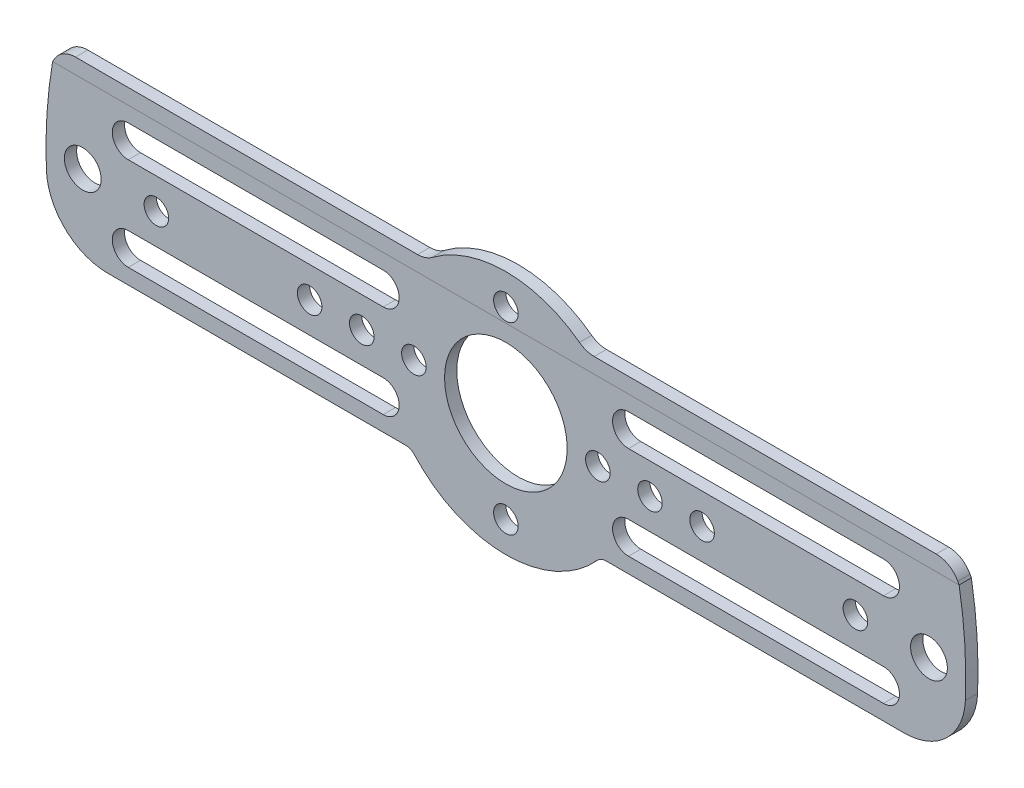
from build123d import *

# Parameters (mm, degrees)
SKETCH1_R           = 2
SKETCH1_R_2         = 3
BOSS_EXTRUDE1_DEPTH = 2
SKETCH3_R           = 10
SKETCH3_R_2         = 2
CUT_EXTRUDE1_DEPTH  = 93.316865626
CUT_EXTRUDE2_DEPTH  = 93.316865626
CUT_EXTRUDE3_DEPTH  = 93.316865626
FILLET1_R           = 2
FILLET2_DEPTH       = 2
FILLET3_DEPTH       = 2
FILLET4_DEPTH       = 2
FILLET5_DEPTH       = 2
FILLET6_R           = 10
CUT_EXTRUDE4_START  = -10
CUT_EXTRUDE4_DEPTH  = 10
FILLET7_R           = 4


with BuildPart() as part:
    # Sketch1 → Boss-Extrude1 (new body)
    with BuildSketch(Plane.XY):
        with BuildLine():
            Line((-73.916912814, -12.7), (-15.450242717, -12.7))
            ThreePointArc((-15.450242717, -12.7), (0, -20), (15.450242717, -12.7))
            Line((15.450242717, -12.7), (73.916912814, -12.7))
            ThreePointArc((73.916912814, -12.7), (75, 0), (73.916912814, 12.7))
            Line((73.916912814, 12.7), (53.192030909, 51.162152625))
            ThreePointArc((53.192030909, 51.162152625), (51.353674008, 53.083322806), (48.790367902, 53.790367902))
            Line((48.790367902, 53.790367902), (-48.790367902, 53.790367902))
            ThreePointArc((-48.790367902, 53.790367902), (-51.353674008, 53.083322806), (-53.192030909, 51.162152625))
            Line((-53.192030909, 51.162152625), (-73.916912814, 12.7))
            ThreePointArc((-73.916912814, 12.7), (-75, 0), (-73.916912814, -12.7))
        make_face()
        with Locations((0, 15)):
            Circle(SKETCH1_R, mode=Mode.SUBTRACT)
        with Locations((15, 0)):
            Circle(SKETCH1_R, mode=Mode.SUBTRACT)
        with Locations((0, -15)):
            Circle(SKETCH1_R, mode=Mode.SUBTRACT)
        with Locations((-15, 0)):
            Circle(SKETCH1_R, mode=Mode.SUBTRACT)
        with Locations((-48.790367902, 48.790367902)):
            Circle(SKETCH1_R_2, mode=Mode.SUBTRACT)
        with Locations((-69, 0)):
            Circle(SKETCH1_R_2, mode=Mode.SUBTRACT)
        with Locations(Location((69, 0, 0), (0, 0, 180))):
            Circle(SKETCH1_R_2, mode=Mode.SUBTRACT)
        with Locations(Location((48.790367902, 48.790367902, 0), (0, 0, 180))):
            Circle(SKETCH1_R_2, mode=Mode.SUBTRACT)
    extrude(amount=BOSS_EXTRUDE1_DEPTH)

    # Sketch3 → Cut-Extrude1 (cut, through all)
    with BuildSketch(Plane(origin=(0, 0, 0), x_dir=(-1, 0, 0), z_dir=(0, 0, -1))):
        Circle(SKETCH3_R)
        with Locations((-57, 0)):
            Circle(SKETCH3_R_2)
        with Locations((-32, 0)):
            Circle(SKETCH3_R_2)
        with Locations((-23.5, 0)):
            Circle(SKETCH3_R_2)
        with Locations(Location((23.5, 0, 0), (0, 0, 180))):
            Circle(SKETCH3_R_2)
        with Locations(Location((32, 0, 0), (0, 0, 180))):
            Circle(SKETCH3_R_2)
        with Locations(Location((57, 0, 0), (0, 0, 180))):
            Circle(SKETCH3_R_2)
    extrude(amount=-CUT_EXTRUDE1_DEPTH, mode=Mode.SUBTRACT)

    # Sketch5 → Cut-Extrude2 (cut, through all)
    with BuildSketch(Plane.XY.offset(2)):
        with BuildLine():
            ThreePointArc((-47.496272676, 43.96073877), (-49.370145809, 43.824095902), (-51.162152637, 44.388704901))
            Line((-51.162152637, 44.388704901), (-66.890145502, 15.2))
            Line((-66.890145502, 15.2), (-18.735533906, 15.2))
            Line((-18.735533906, 15.2), (-47.496272676, 43.96073877))
        make_face()
        with BuildLine():
            ThreePointArc((43.96073877, 47.496272676), (43.833143595, 48.137736941), (43.790367902, 48.790367902))
            Line((43.790367902, 48.790367902), (-43.790367902, 48.790367902))
            ThreePointArc((-43.790367902, 48.790367902), (-43.833143595, 48.137736941), (-43.96073877, 47.496272676))
            Line((-43.96073877, 47.496272676), (-12.263448247, 15.798982153))
            ThreePointArc((-12.263448247, 15.798982153), (0, 20), (12.263448247, 15.798982153))
            Line((12.263448247, 15.798982153), (43.96073877, 47.496272676))
        make_face()
        with BuildLine():
            Line((47.496272676, 43.96073877), (18.735533906, 15.2))
            Line((18.735533906, 15.2), (66.886464241, 15.2))
            Line((66.886464241, 15.2), (51.159299215, 44.387168561))
            ThreePointArc((51.159299215, 44.387168561), (49.368536342, 43.823908272), (47.496272676, 43.96073877))
        make_face()
    extrude(amount=-CUT_EXTRUDE2_DEPTH, mode=Mode.SUBTRACT)

    # Sketch8 → Cut-Extrude3 (cut, through all)
    with BuildSketch(Plane.XY.offset(2)):
        with BuildLine():
            Line((61.58620553, 10.2), (20, 10.2))
            ThreePointArc((20, 10.2), (17.4, 7.6), (20, 5))
            Line((20, 5), (61.58620553, 5))
            ThreePointArc((61.58620553, 5), (64.18620553, 7.6), (61.58620553, 10.2))
        make_face()
        with BuildLine():
            Line((-61.58620553, -10.2), (-20, -10.2))
            ThreePointArc((-20, -10.2), (-17.4, -7.6), (-20, -5))
            Line((-20, -5), (-61.58620553, -5))
            ThreePointArc((-61.58620553, -5), (-64.18620553, -7.6), (-61.58620553, -10.2))
        make_face()
        with BuildLine():
            Line((61.58620553, -10.2), (20, -10.2))
            ThreePointArc((20, -10.2), (17.4, -7.6), (20, -5))
            Line((20, -5), (61.58620553, -5))
            ThreePointArc((61.58620553, -5), (64.18620553, -7.6), (61.58620553, -10.2))
        make_face()
        with BuildLine():
            Line((-61.58620553, 10.2), (-20, 10.2))
            ThreePointArc((-20, 10.2), (-17.4, 7.6), (-20, 5))
            Line((-20, 5), (-61.58620553, 5))
            ThreePointArc((-61.58620553, 5), (-64.18620553, 7.6), (-61.58620553, 10.2))
        make_face()
    extrude(amount=-CUT_EXTRUDE3_DEPTH, mode=Mode.SUBTRACT)

    # Fillet1
    fillet1_edges = [part.edges().sort_by_distance(p)[0] for p in [
        (12.263448247, 15.798982153, 1),
        (-12.263448247, 15.798982153, 1),
        (66.886464241, 15.2, 1),
        (18.735533906, 15.2, 1),
        (-18.735533906, 15.2, 1),
        (-66.890145502, 15.2, 1),
        (-15.450242717, -12.7, 1),
        (15.450242717, -12.7, 1),
    ]]
    fillet(fillet1_edges, radius=FILLET1_R)

    # Fillet2: read off the stored shape, not the designer's step
    # Fillet2 outline → Fillet2 (add)
    with BuildSketch(Plane.XY):
        with BuildLine():
            Line((-43.96073877, 47.496272676), (-43.584387401, 47.119921307))
            add(Edge.make_bspline(
                [(-43.584387401, 47.119921307), (-43.79719002, 47.332723926), (-43.913795032, 47.634492314), (-43.857793188, 47.97201181)],
                knots=[0, 0, 0, 0, 0.414217666, 0.414217666, 0.414217666, 0.414217666], degree=3, weights=[1, 0.829531048, 0.729673348, 0.700426898]))
            ThreePointArc((-43.857793188, 47.97201181), (-43.903473396, 47.732888781), (-43.96073877, 47.496272676))
        make_face()
        with BuildLine():
            ThreePointArc((-43.790367902, 48.790367902), (-43.807252733, 48.379803393), (-43.857793188, 47.97201181))
            add(Edge.make_bspline(
                [(-43.857793188, 47.97201181), (-43.770111484, 48.500463775), (-43.357659279, 48.790367902), (-42.892465766, 48.790367902)],
                knots=[0.414217666, 0.414217666, 0.414217666, 0.414217666, 1, 1, 1, 1], degree=3, weights=[0.700426898, 0.659066873, 0.758924573, 1]))
            Line((-42.892465766, 48.790367902), (-43.790367902, 48.790367902))
        make_face()
    extrude(amount=FILLET2_DEPTH)

    # Fillet3: read off the stored shape, not the designer's step
    # Fillet3 outline → Fillet3 (add)
    with BuildSketch(Plane.XY):
        with BuildLine():
            Line((43.790367902, 48.790367902), (42.892465766, 48.790367902))
            add(Edge.make_bspline(
                [(42.892465766, 48.790367902), (43.357665683, 48.790367902), (43.770121408, 48.5004568), (43.857795774, 47.971996226)],
                knots=[0, 0, 0, 0, 0.585788454, 0.585788454, 0.585788454, 0.585788454], degree=3, weights=[1, 0.758922055, 0.659064787, 0.700428195]))
            ThreePointArc((43.857795774, 47.971996226), (43.807253382, 48.379795521), (43.790367902, 48.790367902))
        make_face()
        with BuildLine():
            ThreePointArc((43.96073877, 47.496272676), (43.903475067, 47.732881061), (43.857795774, 47.971996226))
            add(Edge.make_bspline(
                [(43.857795774, 47.971996226), (43.913791115, 47.634482177), (43.79718623, 47.332720136), (43.584387401, 47.119921307)],
                knots=[0.585788454, 0.585788454, 0.585788454, 0.585788454, 1, 1, 1, 1], degree=3, weights=[0.700428195, 0.729676298, 0.829533567, 1]))
            Line((43.584387401, 47.119921307), (43.96073877, 47.496272676))
        make_face()
    extrude(amount=FILLET3_DEPTH)

    # Fillet4: read off the stored shape, not the designer's step
    # Fillet4 outline → Fillet4 (add)
    with BuildSketch(Plane.XY):
        with BuildLine():
            Line((-51.162152637, 44.388704901), (-52.646203675, 41.634537337))
            add(Edge.make_bspline(
                [(-52.646203675, 41.634537337), (-51.92183636, 42.978850243), (-50.576640467, 43.835721987), (-48.922136441, 43.792104498)],
                knots=[0, 0, 0, 0, 0.585786442, 0.585786442, 0.585786442, 0.585786442], degree=3, weights=[1, 0.842637329, 0.777455577, 0.804454744]))
            ThreePointArc((-48.922136441, 43.792104498), (-50.077196468, 43.958797532), (-51.162152637, 44.388704901))
        make_face()
        with BuildLine():
            ThreePointArc((-47.496272676, 43.96073877), (-48.203119904, 43.824973679), (-48.922136441, 43.792104498))
            add(Edge.make_bspline(
                [(-48.922136441, 43.792104498), (-47.817700519, 43.762988388), (-46.849981733, 43.314447827), (-46.126053502, 42.590519596)],
                knots=[0.585786442, 0.585786442, 0.585786442, 0.585786442, 1, 1, 1, 1], degree=3, weights=[0.804454744, 0.823546038, 0.88872779, 1]))
            Line((-46.126053502, 42.590519596), (-47.496272676, 43.96073877))
        make_face()
    extrude(amount=FILLET4_DEPTH)

    # Fillet5: read off the stored shape, not the designer's step
    # Fillet5 outline → Fillet5 (add)
    with BuildSketch(Plane.XY):
        with BuildLine():
            Line((47.496272676, 43.96073877), (46.127063611, 42.591529705))
            add(Edge.make_bspline(
                [(46.127063611, 42.591529705), (46.850510453, 43.314976547), (47.817619792, 43.763154251), (48.921332432, 43.792083367)],
                knots=[0, 0, 0, 0, 0.414289791, 0.414289791, 0.414289791, 0.414289791], degree=3, weights=[1, 0.888707311, 0.823522047, 0.804444208]))
            ThreePointArc((48.921332432, 43.792083367), (48.202720546, 43.825020926), (47.496272676, 43.96073877))
        make_face()
        with BuildLine():
            ThreePointArc((51.159299215, 44.387168561), (50.075241983, 43.958277402), (48.921332432, 43.792083367))
            add(Edge.make_bspline(
                [(48.921332432, 43.792083367), (50.574149341, 43.835404908), (51.917905025, 42.979314342), (52.641529007, 41.636380946)],
                knots=[0.414289791, 0.414289791, 0.414289791, 0.414289791, 1, 1, 1, 1], degree=3, weights=[0.804444208, 0.777472544, 0.842657808, 1]))
            Line((52.641529007, 41.636380946), (51.159299215, 44.387168561))
        make_face()
    extrude(amount=FILLET5_DEPTH)

    # Fillet6
    fillet6_edges = [part.edges().sort_by_distance(p)[0] for p in [
        (-73.916912814, -12.7, 1),
        (73.916912814, -12.7, 1),
    ]]
    fillet(fillet6_edges, radius=FILLET6_R)

    # Sketch9 → Cut-Extrude4 (cut)
    with BuildSketch(Plane.XY.offset(2).offset(CUT_EXTRUDE4_START)):
        with BuildLine():
            Line((72.569817001, 15.2), (53.192030909, 51.162152625))
            ThreePointArc((53.192030909, 51.162152625), (51.353674008, 53.083322806), (48.790367902, 53.790367902))
            Line((48.790367902, 53.790367902), (-48.790367902, 53.790367902))
            ThreePointArc((-48.790367902, 53.790367902), (-51.353674008, 53.083322806), (-53.192030909, 51.162152625))
            Line((-53.192030909, 51.162152625), (-72.569817001, 15.2))
            Line((-72.569817001, 15.2), (-12.998461447, 15.2))
            ThreePointArc((-12.998461447, 15.2), (0, 20), (12.998461447, 15.2))
            Line((12.998461447, 15.2), (72.569817001, 15.2))
        make_face()
    extrude(amount=CUT_EXTRUDE4_DEPTH, mode=Mode.SUBTRACT)

    # Fillet7
    fillet7_edges = [part.edges().sort_by_distance(p)[0] for p in [
        (-72.569817001, 15.2, 1),
        (72.569817001, 15.2, 1),
        (-12.998461447, 15.2, 1),
        (12.998461447, 15.2, 1),
    ]]
    fillet(fillet7_edges, radius=FILLET7_R)


solid = part.part
